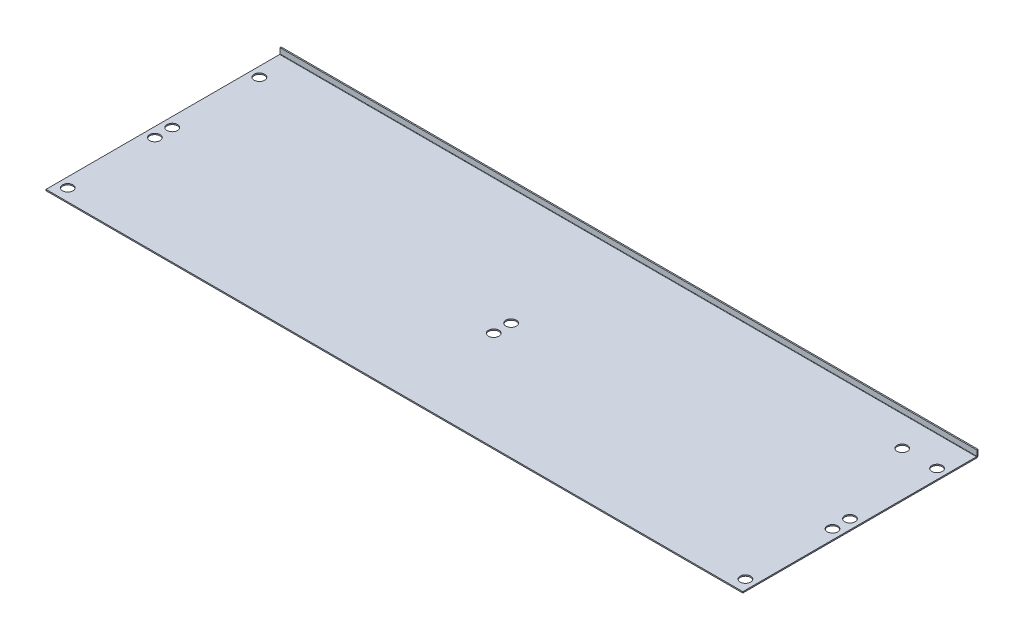
from build123d import *
from build123d.topology import SkipClean

# Parameters (mm, degrees)
SKETCH_1_W                       = 400
SKETCH_1_H                       = 135
SKETCH_1_R                       = 3
SM_BASE_FLANGE_1_DEPTH           = 0.7
SM_EDGE_FLANGE_1_STRIP_W         = 3.2
SM_EDGE_FLANGE_1_STRIP_H         = 0.7
SM_EDGE_FLANGE_1_STRIP_CUT_DEPTH = 400
SM_EDGE_FLANGE_1_DEPTH           = 400
MOVE_START                       = -0.5
MOVE_BODY_1_OUTLINE_W            = 400
MOVE_BODY_1_OUTLINE_H            = 134.3
MOVE_BODY_1_OUTLINE_R            = 3
MOVE_BODY_1_DEPTH                = 0.5
MOVE_START_2                     = -4
MOVE_BODY_1_2_OUTLINE_W          = 400
MOVE_BODY_1_2_OUTLINE_H          = 0.7
MOVE_BODY_1_2_DEPTH              = 2.6
MOVE_START_3                     = -1.315058
MOVE_BODY_1_3_OUTLINE_W          = 400
MOVE_BODY_1_3_OUTLINE_H          = 134.3
MOVE_BODY_1_3_OUTLINE_R          = 3
MOVE_BODY_1_3_DEPTH              = 0.615058
MOVE_BODY_1_4_OUTLINE_W          = 400
MOVE_BODY_1_4_OUTLINE_H          = 0.7
MOVE_BODY_1_4_DEPTH              = 3.1
MOVE_START_4                     = -1.4
MOVE_BODY_1_5_OUTLINE_W          = 400
MOVE_BODY_1_5_OUTLINE_H          = 134.3
MOVE_BODY_1_5_OUTLINE_R          = 3
MOVE_BODY_1_5_DEPTH              = 0.084942
MOVE_START_5                     = -0.639415385
MOVE_BODY_1_6_OUTLINE_W          = 400
MOVE_BODY_1_6_OUTLINE_H          = 0.7
MOVE_BODY_1_6_DEPTH              = 0.139415385
MOVE_START_6                     = -200
MOVE_BODY_1_7_DEPTH              = 400
MOVE_BODY_1_8_DEPTH              = 400


with BuildPart() as part:
    # 基体-法兰1: sheet metal written as solids
    # 草图1 → 基体-法兰1 (new body)
    with BuildSketch(Plane(origin=(0, 0, 0), x_dir=(1, 0, 0), z_dir=(0, 1, 0))):
        Rectangle(SKETCH_1_W, SKETCH_1_H)
        with Locations(Location((-194.5, -60.5, 0), (0, 0, 270))):
            Circle(SKETCH_1_R, mode=Mode.SUBTRACT)
        with Locations(Location((-194.5, -10.5, 0), (0, 0, 270))):
            Circle(SKETCH_1_R, mode=Mode.SUBTRACT)
        with Locations(Location((-194.5, -0.5, 0), (0, 0, 270))):
            Circle(SKETCH_1_R, mode=Mode.SUBTRACT)
        with Locations(Location((-194.5, 49.5, 0), (0, 0, 270))):
            Circle(SKETCH_1_R, mode=Mode.SUBTRACT)
        with Locations(Location((0, -10.5, 0), (0, 0, 270))):
            Circle(SKETCH_1_R, mode=Mode.SUBTRACT)
        with Locations(Location((0, -0.5, 0), (0, 0, 270))):
            Circle(SKETCH_1_R, mode=Mode.SUBTRACT)
        with Locations(Location((194.5, -60.5, 0), (0, 0, 90))):
            Circle(SKETCH_1_R, mode=Mode.SUBTRACT)
        with Locations(Location((194.5, -10.5, 0), (0, 0, 90))):
            Circle(SKETCH_1_R, mode=Mode.SUBTRACT)
        with Locations(Location((194.5, -0.5, 0), (0, 0, 90))):
            Circle(SKETCH_1_R, mode=Mode.SUBTRACT)
        with Locations(Location((194.5, 49.5, 0), (0, 0, 90))):
            Circle(SKETCH_1_R, mode=Mode.SUBTRACT)
        with Locations(Location((174.5, 49.5, 0), (0, 0, 270))):
            Circle(SKETCH_1_R, mode=Mode.SUBTRACT)
    extrude(amount=-SM_BASE_FLANGE_1_DEPTH)

    # 边线-法兰1: sheet metal written as solids
    # 边线-法兰1 strip (on a plane across the edge) → 边线-法兰1 strip cut (cut)
    with BuildSketch(Plane(origin=(-200, -0.7, -67.5), x_dir=(0, 0, 1), z_dir=(1, 0, 0))):
        with Locations((-0.7, -0.35)):
            Rectangle(SM_EDGE_FLANGE_1_STRIP_W, SM_EDGE_FLANGE_1_STRIP_H)
    extrude(amount=SM_EDGE_FLANGE_1_STRIP_CUT_DEPTH, mode=Mode.SUBTRACT)

    # 边线-法兰1 section (on a plane across the edge) → 边线-法兰1 (add)
    with BuildSketch(Plane(origin=(-200, -0.7, -67.5), x_dir=(0, 0, 1), z_dir=(1, 0, 0))):
        with BuildLine():
            Line((0, 0.2), (0, 3.3))
            Line((0, 3.3), (0.7, 3.3))
            Line((0.7, 3.3), (0.7, 0.2))
            ThreePointArc((0.7, 0.2), (0.758578644, 0.058578644), (0.9, 0))
            Line((0.9, 0), (0.9, -0.7))
            ThreePointArc((0.9, -0.7), (0.263603897, -0.436396103), (0, 0.2))
        make_face()
    extrude(amount=SM_EDGE_FLANGE_1_DEPTH)

    # Move Body 1: read off the stored shape, not the designer's step
    # Move Body 1 outline → Move Body 1 (cut)
    with BuildSketch(Plane(origin=(0, 0, 0), x_dir=(1, 0, 0), z_dir=(0, 1, 0)).offset(MOVE_START)):
        with Locations((0, -0.35)):
            Rectangle(MOVE_BODY_1_OUTLINE_W, MOVE_BODY_1_OUTLINE_H)
        with Locations((-194.5, -60.5)):
            Circle(MOVE_BODY_1_OUTLINE_R, mode=Mode.SUBTRACT)
        with Locations((-194.5, -10.5)):
            Circle(MOVE_BODY_1_OUTLINE_R, mode=Mode.SUBTRACT)
        with Locations((-194.5, -0.5)):
            Circle(MOVE_BODY_1_OUTLINE_R, mode=Mode.SUBTRACT)
        with Locations((194.5, -60.5)):
            Circle(MOVE_BODY_1_OUTLINE_R, mode=Mode.SUBTRACT)
        with Locations((0, -10.5)):
            Circle(MOVE_BODY_1_OUTLINE_R, mode=Mode.SUBTRACT)
        with Locations((0, -0.5)):
            Circle(MOVE_BODY_1_OUTLINE_R, mode=Mode.SUBTRACT)
        with Locations((194.5, -10.5)):
            Circle(MOVE_BODY_1_OUTLINE_R, mode=Mode.SUBTRACT)
        with Locations((194.5, -0.5)):
            Circle(MOVE_BODY_1_OUTLINE_R, mode=Mode.SUBTRACT)
        with Locations((-194.5, 49.5)):
            Circle(MOVE_BODY_1_OUTLINE_R, mode=Mode.SUBTRACT)
        with Locations((174.5, 49.5)):
            Circle(MOVE_BODY_1_OUTLINE_R, mode=Mode.SUBTRACT)
        with Locations((194.5, 49.5)):
            Circle(MOVE_BODY_1_OUTLINE_R, mode=Mode.SUBTRACT)
    extrude(amount=MOVE_BODY_1_DEPTH, mode=Mode.SUBTRACT)

    # Move Body 1 2 outline → Move Body 1 2 (cut)
    with BuildSketch(Plane(origin=(0, 0, 0), x_dir=(1, 0, 0), z_dir=(0, 1, 0)).offset(MOVE_START_2)):
        with Locations((0, 67.15)):
            Rectangle(MOVE_BODY_1_2_OUTLINE_W, MOVE_BODY_1_2_OUTLINE_H)
    extrude(amount=MOVE_BODY_1_2_DEPTH, mode=Mode.SUBTRACT)

    # Move Body 1 3 outline → Move Body 1 3 (add)
    with SkipClean():  # the faces are left unmerged after this step: merging them gives an invalid solid
        with BuildSketch(Plane(origin=(0, 0, 0), x_dir=(1, 0, 0), z_dir=(0, 1, 0)).offset(MOVE_START_3)):
            with Locations((0, -0.35)):
                Rectangle(MOVE_BODY_1_3_OUTLINE_W, MOVE_BODY_1_3_OUTLINE_H)
            with Locations((-194.5, -60.5)):
                Circle(MOVE_BODY_1_3_OUTLINE_R, mode=Mode.SUBTRACT)
            with Locations((-194.5, -10.5)):
                Circle(MOVE_BODY_1_3_OUTLINE_R, mode=Mode.SUBTRACT)
            with Locations((-194.5, -0.5)):
                Circle(MOVE_BODY_1_3_OUTLINE_R, mode=Mode.SUBTRACT)
            with Locations((194.5, -60.5)):
                Circle(MOVE_BODY_1_3_OUTLINE_R, mode=Mode.SUBTRACT)
            with Locations((0, -10.5)):
                Circle(MOVE_BODY_1_3_OUTLINE_R, mode=Mode.SUBTRACT)
            with Locations((0, -0.5)):
                Circle(MOVE_BODY_1_3_OUTLINE_R, mode=Mode.SUBTRACT)
            with Locations((194.5, -10.5)):
                Circle(MOVE_BODY_1_3_OUTLINE_R, mode=Mode.SUBTRACT)
            with Locations((194.5, -0.5)):
                Circle(MOVE_BODY_1_3_OUTLINE_R, mode=Mode.SUBTRACT)
            with Locations((-194.5, 49.5)):
                Circle(MOVE_BODY_1_3_OUTLINE_R, mode=Mode.SUBTRACT)
            with Locations((174.5, 49.5)):
                Circle(MOVE_BODY_1_3_OUTLINE_R, mode=Mode.SUBTRACT)
            with Locations((194.5, 49.5)):
                Circle(MOVE_BODY_1_3_OUTLINE_R, mode=Mode.SUBTRACT)
        extrude(amount=MOVE_BODY_1_3_DEPTH)

    # Move Body 1 4 outline → Move Body 1 4 (add)
    with SkipClean():  # the faces are left unmerged after this step: merging them gives an invalid solid
        with BuildSketch(Plane(origin=(0, 0, 0), x_dir=(1, 0, 0), z_dir=(0, 1, 0)).offset(MOVE_START)):
            with Locations((0, 67.15)):
                Rectangle(MOVE_BODY_1_4_OUTLINE_W, MOVE_BODY_1_4_OUTLINE_H)
        extrude(amount=MOVE_BODY_1_4_DEPTH)

    # Move Body 1 5 outline → Move Body 1 5 (add)
    with SkipClean():  # the faces are left unmerged after this step: merging them gives an invalid solid
        with BuildSketch(Plane(origin=(0, 0, 0), x_dir=(1, 0, 0), z_dir=(0, 1, 0)).offset(MOVE_START_4)):
            with Locations((0, -0.35)):
                Rectangle(MOVE_BODY_1_5_OUTLINE_W, MOVE_BODY_1_5_OUTLINE_H)
            with Locations((-194.5, -60.5)):
                Circle(MOVE_BODY_1_5_OUTLINE_R, mode=Mode.SUBTRACT)
            with Locations((-194.5, -10.5)):
                Circle(MOVE_BODY_1_5_OUTLINE_R, mode=Mode.SUBTRACT)
            with Locations((-194.5, -0.5)):
                Circle(MOVE_BODY_1_5_OUTLINE_R, mode=Mode.SUBTRACT)
            with Locations((194.5, -60.5)):
                Circle(MOVE_BODY_1_5_OUTLINE_R, mode=Mode.SUBTRACT)
            with Locations((0, -10.5)):
                Circle(MOVE_BODY_1_5_OUTLINE_R, mode=Mode.SUBTRACT)
            with Locations((0, -0.5)):
                Circle(MOVE_BODY_1_5_OUTLINE_R, mode=Mode.SUBTRACT)
            with Locations((194.5, -10.5)):
                Circle(MOVE_BODY_1_5_OUTLINE_R, mode=Mode.SUBTRACT)
            with Locations((194.5, -0.5)):
                Circle(MOVE_BODY_1_5_OUTLINE_R, mode=Mode.SUBTRACT)
            with Locations((-194.5, 49.5)):
                Circle(MOVE_BODY_1_5_OUTLINE_R, mode=Mode.SUBTRACT)
            with Locations((174.5, 49.5)):
                Circle(MOVE_BODY_1_5_OUTLINE_R, mode=Mode.SUBTRACT)
            with Locations((194.5, 49.5)):
                Circle(MOVE_BODY_1_5_OUTLINE_R, mode=Mode.SUBTRACT)
        extrude(amount=MOVE_BODY_1_5_DEPTH)

    # Move Body 1 6 outline → Move Body 1 6 (add)
    with SkipClean():  # the faces are left unmerged after this step: merging them gives an invalid solid
        with BuildSketch(Plane(origin=(0, 0, 0), x_dir=(1, 0, 0), z_dir=(0, 1, 0)).offset(MOVE_START_5)):
            with Locations((0, 67.15)):
                Rectangle(MOVE_BODY_1_6_OUTLINE_W, MOVE_BODY_1_6_OUTLINE_H)
        extrude(amount=MOVE_BODY_1_6_DEPTH)

    # Move Body 1 7 outline → Move Body 1 7 (cut)
    with BuildSketch(Plane.YZ.offset(MOVE_START_6)):
        with BuildLine():
            Line((-0.5, 67.5), (-0.7, 67.5))
            Line((-0.7, 67.5), (-0.7, -66.6))
            ThreePointArc((-0.7, -66.6), (-0.641421356, -66.741421356), (-0.5, -66.8))
            Line((-0.5, -66.8), (-0.5, 67.5))
        make_face()
        with BuildLine():
            ThreePointArc((-0.5, -67.5), (-0.569919006, -67.497279963), (-0.639415385, -67.489136295))
            Line((-0.639415385, -67.489136295), (-0.639415385, -67.5))
            Line((-0.639415385, -67.5), (-0.5, -67.5))
        make_face()
        with BuildLine():
            ThreePointArc((-0.7, -67.477496439), (-1.203562364, -67.161248608), (-1.4, -66.6))
            Line((-1.4, -66.6), (-1.4, -67.5))
            Line((-1.4, -67.5), (-0.9, -67.5))
            ThreePointArc((-0.9, -67.5), (-0.799368978, -67.494356415), (-0.7, -67.477496439))
        make_face()
    extrude(amount=MOVE_BODY_1_7_DEPTH, mode=Mode.SUBTRACT)

    # Move Body 1 8 outline → Move Body 1 8 (add)
    with BuildSketch(Plane.YZ.offset(MOVE_START_6)):
        with BuildLine():
            ThreePointArc((-0.639415385, -67.461449742), (-0.669567969, -67.47000062), (-0.7, -67.477496439))
            ThreePointArc((-0.7, -67.477496439), (-0.669807457, -67.483835634), (-0.639415385, -67.489136295))
            Line((-0.639415385, -67.489136295), (-0.639415385, -67.461449742))
        make_face()
    extrude(amount=MOVE_BODY_1_8_DEPTH)


solid = part.part
